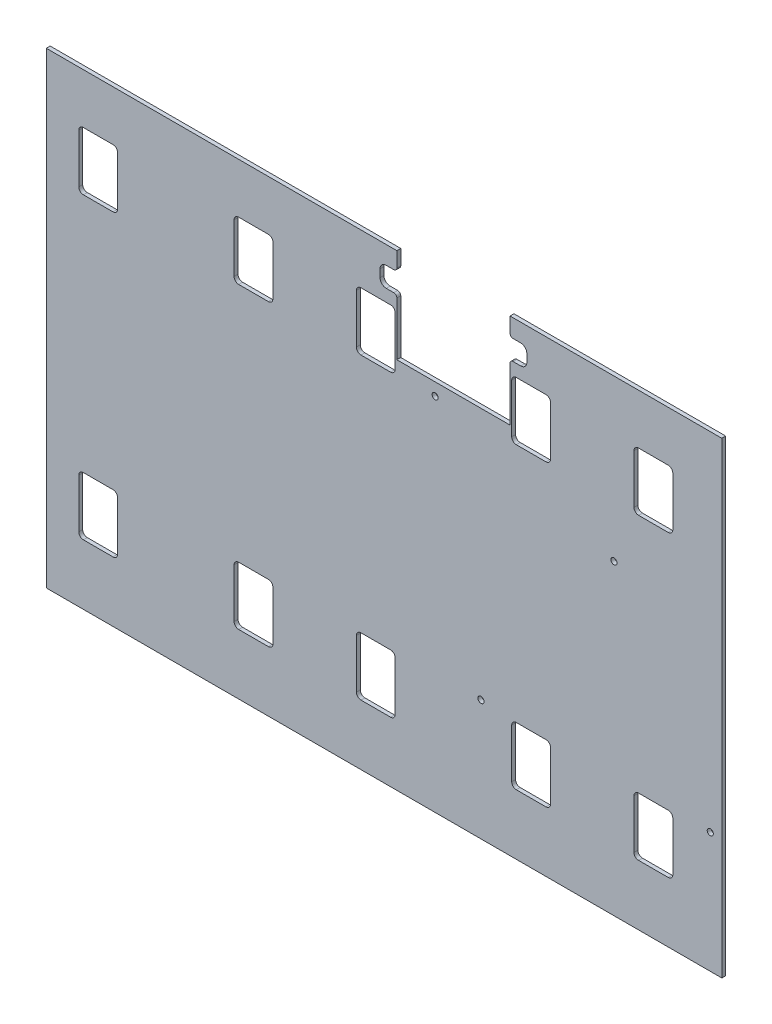
from build123d import *

# Parameters (mm, degrees)
SKETCH1_W           = 441.979400076
SKETCH1_H           = 305.81676
BOSS_EXTRUDE1_DEPTH = 2.54
CUT_EXTRUDE1_DEPTH  = 271.648139079
LPATTERN1_COUNT     = 3
LPATTERN1_PITCH     = 181.613999992
CUT_EXTRUDE2_DEPTH  = 271.648139079
LPATTERN2_COUNT     = 2
LPATTERN2_PITCH     = 181.613999992
SKETCH5_W           = 68
SKETCH5_H           = 60
CUT_EXTRUDE3_DEPTH  = 271.648139079
SKETCH6_R           = 2
CUT_EXTRUDE4_DEPTH  = 271.648139079


with BuildPart() as part:
    # Sketch1 → Boss-Extrude1 (new body)
    with BuildSketch(Plane.XY):
        with Locations((0, -3.32067)):
            Rectangle(SKETCH1_W, SKETCH1_H)
    extrude(amount=BOSS_EXTRUDE1_DEPTH)

    # Sketch2 → Cut-Extrude1 (cut, through all)
    with BuildSketch(Plane.XY.offset(2.54)):
        with BuildLine():
            ThreePointArc((-196.715375, -78.7), (-198.836695344, -79.578679656), (-199.715375, -81.7))
            Line((-199.715375, -81.7), (-199.715375, -113.8))
            ThreePointArc((-199.715375, -113.8), (-198.836695344, -115.921320344), (-196.715375, -116.8))
            Line((-196.715375, -116.8), (-177.315375, -116.8))
            ThreePointArc((-177.315375, -116.8), (-175.194054656, -115.921320344), (-174.315375, -113.8))
            Line((-174.315375, -113.8), (-174.315375, -81.7))
            ThreePointArc((-174.315375, -81.7), (-175.194054656, -79.578679656), (-177.315375, -78.7))
            Line((-177.315375, -78.7), (-196.715375, -78.7))
        make_face()
        with BuildLine():
            ThreePointArc((-196.715375, 116.8), (-198.836695344, 115.921320344), (-199.715375, 113.8))
            Line((-199.715375, 113.8), (-199.715375, 81.7))
            ThreePointArc((-199.715375, 81.7), (-198.836695344, 79.578679656), (-196.715375, 78.7))
            Line((-196.715375, 78.7), (-177.315375, 78.7))
            ThreePointArc((-177.315375, 78.7), (-175.194054656, 79.578679656), (-174.315375, 81.7))
            Line((-174.315375, 81.7), (-174.315375, 113.8))
            ThreePointArc((-174.315375, 113.8), (-175.194054656, 115.921320344), (-177.315375, 116.8))
            Line((-177.315375, 116.8), (-196.715375, 116.8))
        make_face()
    cut_extrude1 = extrude(amount=-CUT_EXTRUDE1_DEPTH, mode=Mode.SUBTRACT)

    # LPattern1: Cut-Extrude1 ×3
    with Locations(*[(i * LPATTERN1_PITCH, 0, 0) for i in range(1, LPATTERN1_COUNT)]):
        add(cut_extrude1, mode=Mode.SUBTRACT)

    # Sketch3 → Cut-Extrude2 (cut, through all)
    with BuildSketch(Plane.XY.offset(2.54)):
        with BuildLine():
            ThreePointArc((-98.112625, 81.7), (-97.233945344, 79.578679656), (-95.112625, 78.7))
            Line((-95.112625, 78.7), (-75.712625, 78.7))
            ThreePointArc((-75.712625, 78.7), (-73.591304656, 79.578679656), (-72.712625, 81.7))
            Line((-72.712625, 81.7), (-72.712625, 113.8))
            ThreePointArc((-72.712625, 113.8), (-73.591304656, 115.921320344), (-75.712625, 116.8))
            Line((-75.712625, 116.8), (-95.112625, 116.8))
            ThreePointArc((-95.112625, 116.8), (-97.233945344, 115.921320344), (-98.112625, 113.8))
            Line((-98.112625, 113.8), (-98.112625, 81.7))
        make_face()
        with BuildLine():
            ThreePointArc((-75.712625, -116.8), (-73.591304656, -115.921320344), (-72.712625, -113.8))
            Line((-72.712625, -113.8), (-72.712625, -81.7))
            ThreePointArc((-72.712625, -81.7), (-73.591304656, -79.578679656), (-75.712625, -78.7))
            Line((-75.712625, -78.7), (-95.112625, -78.7))
            ThreePointArc((-95.112625, -78.7), (-97.233945344, -79.578679656), (-98.112625, -81.7))
            Line((-98.112625, -81.7), (-98.112625, -113.8))
            ThreePointArc((-98.112625, -113.8), (-97.233945344, -115.921320344), (-95.112625, -116.8))
            Line((-95.112625, -116.8), (-75.712625, -116.8))
        make_face()
    cut_extrude2 = extrude(amount=-CUT_EXTRUDE2_DEPTH, mode=Mode.SUBTRACT)

    # LPattern2: Cut-Extrude2 ×2
    with Locations(*[(i * LPATTERN2_PITCH, 0, 0) for i in range(1, LPATTERN2_COUNT)]):
        add(cut_extrude2, mode=Mode.SUBTRACT)

    # Sketch5 → Cut-Extrude3 (cut, through all)
    with BuildSketch(Plane.XY.offset(2.54)):
        with BuildLine():
            ThreePointArc((6.399999992, 124.77171), (7.802899846, 124.190609854), (8.383999992, 122.78771))
            Line((8.383999992, 122.78771), (8.383999992, 87.77171))
            Line((8.383999992, 87.77171), (82.415999992, 87.77171))
            Line((82.415999992, 87.77171), (82.415999992, 122.78771))
            ThreePointArc((82.415999992, 122.78771), (82.997100138, 124.190609854), (84.399999992, 124.77171))
            Line((84.399999992, 124.77171), (89.399999992, 124.77171))
            ThreePointArc((89.399999992, 124.77171), (92.239740825, 125.947969167), (93.415999992, 128.78771))
            Line((93.415999992, 128.78771), (93.415999992, 133.78771))
            ThreePointArc((93.415999992, 133.78771), (92.239740825, 136.627450833), (89.399999992, 137.80371))
            Line((89.399999992, 137.80371), (84.399999992, 137.80371))
            ThreePointArc((84.399999992, 137.80371), (82.997100138, 138.384810146), (82.415999992, 139.78771))
            Line((82.415999992, 139.78771), (82.415999992, 149.80371))
            Line((82.415999992, 149.80371), (8.383999992, 149.80371))
            Line((8.383999992, 149.80371), (8.383999992, 139.78771))
            ThreePointArc((8.383999992, 139.78771), (7.802899846, 138.384810146), (6.399999992, 137.80371))
            Line((6.399999992, 137.80371), (1.399999992, 137.80371))
            ThreePointArc((1.399999992, 137.80371), (-1.439740841, 136.627450833), (-2.616000008, 133.78771))
            Line((-2.616000008, 133.78771), (-2.616000008, 128.78771))
            ThreePointArc((-2.616000008, 128.78771), (-1.439740841, 125.947969167), (1.399999992, 124.77171))
            Line((1.399999992, 124.77171), (6.399999992, 124.77171))
        make_face()
        with BuildLine():
            Line((1.399999992, 136.78771), (6.399999992, 136.78771))
            ThreePointArc((6.399999992, 136.78771), (8.521320336, 137.666389656), (9.399999992, 139.78771))
            Line((9.399999992, 139.78771), (9.399999992, 122.78771))
            ThreePointArc((9.399999992, 122.78771), (8.521320336, 124.909030344), (6.399999992, 125.78771))
            Line((6.399999992, 125.78771), (1.399999992, 125.78771))
            ThreePointArc((1.399999992, 125.78771), (-0.721320352, 126.666389656), (-1.600000008, 128.78771))
            Line((-1.600000008, 128.78771), (-1.600000008, 133.78771))
            ThreePointArc((-1.600000008, 133.78771), (-0.721320352, 135.909030344), (1.399999992, 136.78771))
        make_face(mode=Mode.SUBTRACT)
        with Locations((45.399999992, 118.78771)):
            Rectangle(SKETCH5_W, SKETCH5_H, mode=Mode.SUBTRACT)
        with BuildLine():
            ThreePointArc((81.399999992, 139.78771), (82.278679648, 137.666389656), (84.399999992, 136.78771))
            Line((84.399999992, 136.78771), (89.399999992, 136.78771))
            ThreePointArc((89.399999992, 136.78771), (91.521320336, 135.909030344), (92.399999992, 133.78771))
            Line((92.399999992, 133.78771), (92.399999992, 128.78771))
            ThreePointArc((92.399999992, 128.78771), (91.521320336, 126.666389656), (89.399999992, 125.78771))
            Line((89.399999992, 125.78771), (84.399999992, 125.78771))
            ThreePointArc((84.399999992, 125.78771), (82.278679648, 124.909030344), (81.399999992, 122.78771))
            Line((81.399999992, 122.78771), (81.399999992, 139.78771))
        make_face(mode=Mode.SUBTRACT)
    extrude(amount=-CUT_EXTRUDE3_DEPTH, mode=Mode.SUBTRACT)


with BuildPart() as cut_extrude3_kept_piece:
    # of the separate pieces the step leaves, the one the design keeps (cut_extrude3_pieces_kept)
    add(part.part.solids().sort_by_distance((220.989700038, 149.58771, 0))[0])

    # Sketch6 → Cut-Extrude4 (cut, through all)
    with BuildSketch(Plane.XY.offset(2.54)):
        with Locations((63.425, -77.41229)):
            Circle(SKETCH6_R)
        with Locations((213.425, -77.41229)):
            Circle(SKETCH6_R)
        with Locations((150.425, 44.58771)):
            Circle(SKETCH6_R)
        with Locations((33.425, 79.58771)):
            Circle(SKETCH6_R)
    extrude(amount=-CUT_EXTRUDE4_DEPTH, mode=Mode.SUBTRACT)


solid = cut_extrude3_kept_piece.part
